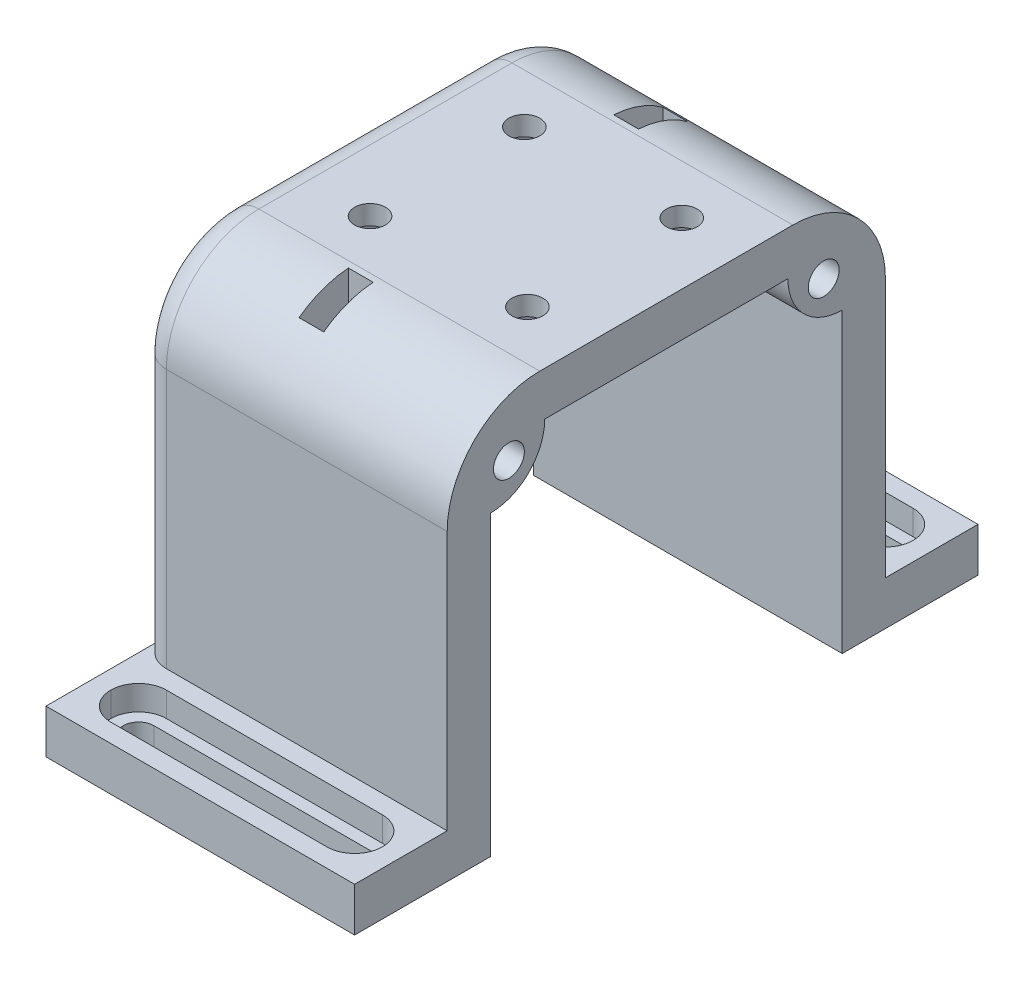
from build123d import *

# Parameters (mm, degrees)
BOSS_EXTRUDE1_DEPTH = 50
SKETCH2_R           = 2.5
CUT_EXTRUDE1_DEPTH  = 50
FILLET1_R           = 15
SKETCH3_W           = 4
SKETCH3_H           = 8
CUT_EXTRUDE2_DEPTH  = 14.54
SKETCH4_W           = 44
SKETCH4_H           = 9
CUT_EXTRUDE3_DEPTH  = 4
SKETCH5_W           = 40
SKETCH5_H           = 5
CUT_EXTRUDE4_DEPTH  = 94.654951818
FILLET2_R           = 2.5
FILLET3_R           = 4.5
FILLET4_R           = 4.5
CUT_EXTRUDE5_START  = -7.129335
SKETCH6_R           = 2.5
CUT_EXTRUDE5_DEPTH  = 4
SKETCH8_R           = 2.5
CUT_EXTRUDE6_DEPTH  = 92.100219539


with BuildPart() as part:
    # Sketch1 → Boss-Extrude1 (new body)
    with BuildSketch(Plane(origin=(0, 0, 0), x_dir=(0, 0, -1), z_dir=(1, 0, 0))):
        with BuildLine():
            Line((35.5, 35.62933491), (-35.5, 35.62933491))
            Line((-35.5, 35.62933491), (-35.5, -21.37066509))
            Line((-35.5, -21.37066509), (-50.5, -21.37066509))
            Line((-50.5, -21.37066509), (-50.5, -28.5))
            Line((-50.5, -28.5), (-28.5, -28.5))
            Line((-28.5, -28.5), (-28.5, 19.7))
            ThreePointArc((-28.5, 19.7), (-22.277460326, 22.277460326), (-19.7, 28.5))
            Line((-19.7, 28.5), (19.7, 28.5))
            ThreePointArc((19.7, 28.5), (22.277460326, 22.277460326), (28.5, 19.7))
            Line((28.5, 19.7), (28.5, -28.5))
            Line((28.5, -28.5), (50.5, -28.5))
            Line((50.5, -28.5), (50.5, -21.37066509))
            Line((50.5, -21.37066509), (35.5, -21.37066509))
            Line((35.5, -21.37066509), (35.5, 35.62933491))
        make_face()
    extrude(amount=BOSS_EXTRUDE1_DEPTH)

    # Sketch2 → Cut-Extrude1 (cut)
    with BuildSketch(Plane.ZY):
        with Locations((-25.5, 25.592902541)):
            Circle(SKETCH2_R)
        with Locations(Location((25.5, 25.592902541, 0), (0, 0, 180))):
            Circle(SKETCH2_R)
    extrude(amount=-CUT_EXTRUDE1_DEPTH, mode=Mode.SUBTRACT)

    # Fillet1
    fillet1_edges = [part.edges().sort_by_distance(p)[0] for p in [
        (25, 35.62933491, 35.5),
        (25, 35.62933491, -35.5),
    ]]
    fillet(fillet1_edges, radius=FILLET1_R)

    # Sketch3 → Cut-Extrude2 (cut)
    with BuildSketch(Plane(origin=(0, 35.62933491, 0), x_dir=(1, 0, 0), z_dir=(0, 1, 0))):
        with Locations((22, 25.5)):
            Rectangle(SKETCH3_W, SKETCH3_H)
        with Locations((22, -25.5)):
            Rectangle(SKETCH3_W, SKETCH3_H)
    extrude(amount=-CUT_EXTRUDE2_DEPTH, mode=Mode.SUBTRACT)

    # Sketch4 → Cut-Extrude3 (cut)
    with BuildSketch(Plane(origin=(0, -21.37066509, 0), x_dir=(1, 0, 0), z_dir=(0, 1, 0))):
        with Locations((25, -43)):
            Rectangle(SKETCH4_W, SKETCH4_H)
        with Locations((25, 43)):
            Rectangle(SKETCH4_W, SKETCH4_H)
    extrude(amount=-CUT_EXTRUDE3_DEPTH, mode=Mode.SUBTRACT)

    # Sketch5 → Cut-Extrude4 (cut, through all)
    with BuildSketch(Plane(origin=(0, -25.37066509, 0), x_dir=(1, 0, 0), z_dir=(0, 1, 0))):
        with Locations((25, -43)):
            Rectangle(SKETCH5_W, SKETCH5_H)
        with Locations((25, 43)):
            Rectangle(SKETCH5_W, SKETCH5_H)
    extrude(amount=-CUT_EXTRUDE4_DEPTH, mode=Mode.SUBTRACT)

    # Fillet2
    fillet2_edges = [part.edges().sort_by_distance(p)[0] for p in [
        (45, -26.935332545, 40.5),
        (45, -26.935332545, 45.5),
        (5, -26.935332545, 45.5),
        (5, -26.935332545, 40.5),
        (5, -26.935332545, -45.5),
        (5, -26.935332545, -40.5),
        (45, -26.935332545, -45.5),
        (45, -26.935332545, -40.5),
    ]]
    fillet(fillet2_edges, radius=FILLET2_R - 0.0001)  # a hair under: the kernel refuses the full size

    # Fillet3
    fillet3_edges = [part.edges().sort_by_distance(p)[0] for p in [
        (3, -23.37066509, 38.5),
        (3, -23.37066509, 47.5),
        (47, -23.37066509, 47.5),
        (47, -23.37066509, 38.5),
        (47, -23.37066509, -47.5),
        (47, -23.37066509, -38.5),
        (3, -23.37066509, -47.5),
        (3, -23.37066509, -38.5),
    ]]
    fillet(fillet3_edges, radius=FILLET3_R - 0.0001)  # a hair under: the kernel refuses the full size

    # Fillet4
    fillet4_edges = [part.edges().sort_by_distance(p)[0] for p in [
        (0, -0.37066509, -35.5),
        (0, -0.37066509, 35.5),
        (0, 35.62933491, 0),
        (0, 31.235936628, -31.106601718),
        (0, 31.235936628, 31.106601718),
    ]]
    fillet(fillet4_edges, radius=FILLET4_R)

    # Sketch6 → Cut-Extrude5 (cut)
    # profile 1 of 4: a face of its own
    with BuildSketch(Plane(origin=(0, 35.62933491, 0), x_dir=(1, 0, 0), z_dir=(0, 1, 0)).offset(CUT_EXTRUDE5_START)):
        Polygon((16.809401077, -8.5), (19.118802154, -12.5), (16.809401077, -16.5), (12.190598923, -16.5), (9.881197846, -12.5), (12.190598923, -8.5), align=None)
        with Locations(Location((14.5, -12.5, 0), (0, 0, 270))):
            Circle(SKETCH6_R, mode=Mode.SUBTRACT)
    # profile 2 of 4: a face of its own
    with BuildSketch(Plane(origin=(0, 35.62933491, 0), x_dir=(1, 0, 0), z_dir=(0, 1, 0)).offset(CUT_EXTRUDE5_START)):
        Polygon((19.118802154, 12.5), (16.809401077, 16.5), (12.190598923, 16.5), (9.881197846, 12.5), (12.190598923, 8.5), (16.809401077, 8.5), align=None)
        with Locations(Location((14.5, 12.5, 0), (0, 0, 270))):
            Circle(SKETCH6_R, mode=Mode.SUBTRACT)
    # profile 3 of 4: a face of its own
    with BuildSketch(Plane(origin=(0, 35.62933491, 0), x_dir=(1, 0, 0), z_dir=(0, 1, 0)).offset(CUT_EXTRUDE5_START)):
        Polygon((42.309401077, -8.5), (37.690598923, -8.5), (35.381197846, -12.5), (37.690598923, -16.5), (42.309401077, -16.5), (44.618802154, -12.5), align=None)
        with Locations(Location((40, -12.5, 0), (0, 0, 270))):
            Circle(SKETCH6_R, mode=Mode.SUBTRACT)
    # profile 4 of 4: a face of its own
    with BuildSketch(Plane(origin=(0, 35.62933491, 0), x_dir=(1, 0, 0), z_dir=(0, 1, 0)).offset(CUT_EXTRUDE5_START)):
        Polygon((37.690598923, 8.5), (35.381197846, 12.5), (37.690598923, 16.5), (42.309401077, 16.5), (44.618802154, 12.5), (42.309401077, 8.5), align=None)
        with Locations(Location((40, 12.5, 0), (0, 0, 270))):
            Circle(SKETCH6_R, mode=Mode.SUBTRACT)
    extrude(amount=CUT_EXTRUDE5_DEPTH, mode=Mode.SUBTRACT)

    # Sketch8 → Cut-Extrude6 (cut, through all)
    with BuildSketch(Plane.XZ.offset(-28.5)):
        with Locations(Location((14.5, -12.5, 0), (0, 0, 270))):
            Circle(SKETCH8_R)
        with Locations(Location((40, 12.5, 0), (0, 0, 270))):
            Circle(SKETCH8_R)
        with Locations(Location((14.5, 12.5, 0), (0, 0, 270))):
            Circle(SKETCH8_R)
        with Locations(Location((40, -12.5, 0), (0, 0, 270))):
            Circle(SKETCH8_R)
    extrude(amount=-CUT_EXTRUDE6_DEPTH, mode=Mode.SUBTRACT)


solid = part.part
